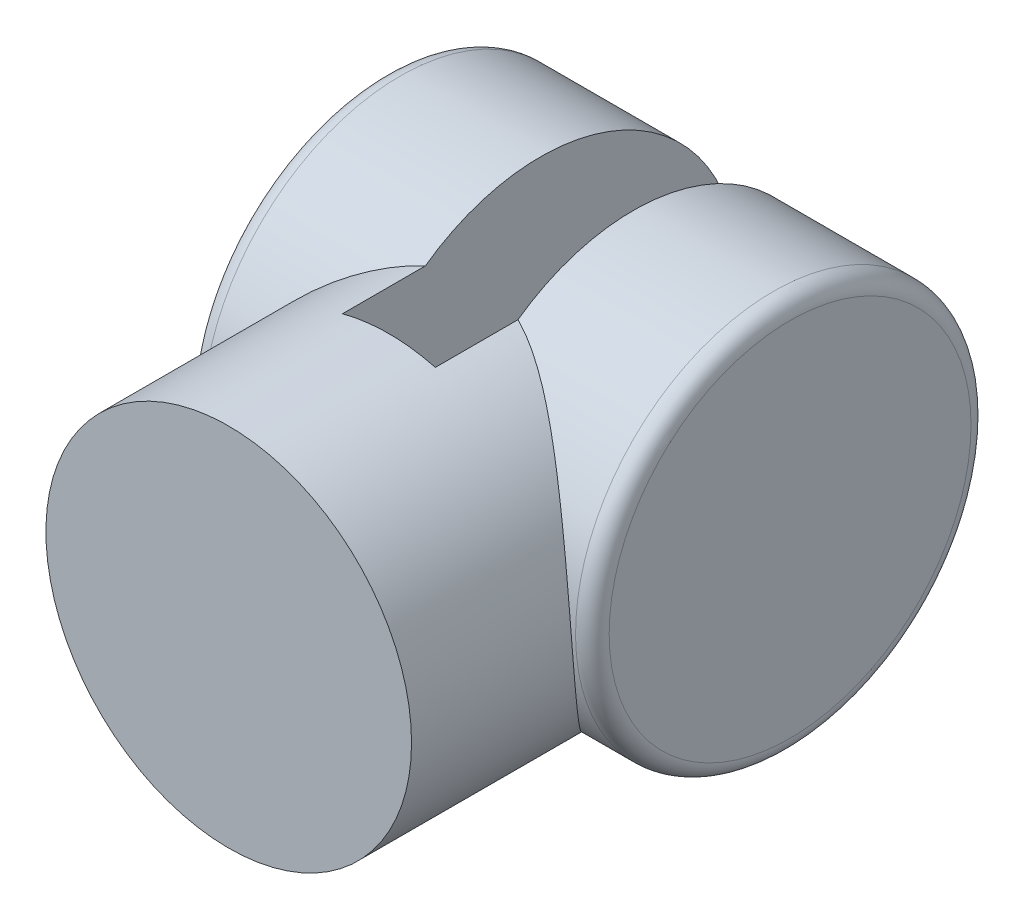
from build123d import *

# Parameters (mm, degrees)
SKETCH1_R               = 62.738
BOSS_EXTRUDE1_DEPTH     = 129.032
FILLET1_R               = 5.334
FILLET2_R               = 5.334
CUT_EXTRUDE1_DEPTH      = 157.593008583
CUT_EXTRUDE1_DEPTH_BACK = 157.593008583
SKETCH2_W               = 29.464
SKETCH2_H               = 125.476
BOSS_EXTRUDE2_START     = 10.518
BOSS_EXTRUDE2_OUTLINE_R = 58
BOSS_EXTRUDE2_DEPTH     = 103.032
CUT_EXTRUDE2_DEPTH      = 184.092449966
CUT_EXTRUDE2_DEPTH_BACK = 184.092449966
SKETCH3_W               = 29.464
SKETCH3_H               = 125.5


# Read off the part's stored shape, not the designer's step: Boss-Extrude2
with BuildPart() as part:
    # Sketch1 → Boss-Extrude1 (new body)
    with BuildSketch(Plane(origin=(0, 0, 0), x_dir=(0, 0, -1), z_dir=(1, 0, 0))):
        Circle(SKETCH1_R)
    extrude(amount=BOSS_EXTRUDE1_DEPTH)

    # Fillet1
    fillet1_edges = [part.edges().sort_by_distance(p)[0] for p in [
        (0, 0, 62.738),
    ]]
    fillet(fillet1_edges, radius=FILLET1_R)

    # Fillet2
    fillet2_edges = [part.edges().sort_by_distance(p)[0] for p in [
        (129.032, 0, 62.738),
    ]]
    fillet(fillet2_edges, radius=FILLET2_R)

    # Sketch2 → Cut-Extrude1 (cut, two sides: drawn at the far end of the back side and taken through both)
    with BuildSketch(Plane.XY.offset(-CUT_EXTRUDE1_DEPTH_BACK)):
        with Locations((64.516, 0)):
            Rectangle(SKETCH2_W, SKETCH2_H)
    extrude(amount=CUT_EXTRUDE1_DEPTH + CUT_EXTRUDE1_DEPTH_BACK, mode=Mode.SUBTRACT)


with BuildPart() as cut_extrude1_piece_1:
    # of the separate pieces the step leaves, piece 1, a body of its own (cut_extrude1_pieces)
    add(part.part.solids().sort_by_distance((5.334, 0, -62.738))[0])



with BuildPart() as cut_extrude1_piece_2:
    # of the separate pieces the step leaves, piece 2, a body of its own (cut_extrude1_pieces)
    add(part.part.solids().sort_by_distance((79.248, 0, -62.738))[0])


with BuildPart() as cut_extrude1_piece_1_1:
    add(cut_extrude1_piece_1.part)

    add(cut_extrude1_piece_2.part)  # Boss-Extrude2 merges Cut-Extrude1 piece 2
    # Boss-Extrude2 outline → Boss-Extrude2 (add)
    with BuildSketch(Plane.XY.offset(BOSS_EXTRUDE2_START)):
        with Locations((64.483080673, -5.087127651)):
            Circle(BOSS_EXTRUDE2_OUTLINE_R)
    extrude(amount=BOSS_EXTRUDE2_DEPTH)

    # Sketch3 → Cut-Extrude2 (cut, two sides: drawn at the far end of the back side and taken through both)
    with BuildSketch(Plane(origin=(0, 0, 0), x_dir=(1, 0, 0), z_dir=(0, 1, 0)).offset(-CUT_EXTRUDE2_DEPTH_BACK)):
        with Locations((64.516, -0.012)):
            Rectangle(SKETCH3_W, SKETCH3_H)
    extrude(amount=CUT_EXTRUDE2_DEPTH + CUT_EXTRUDE2_DEPTH_BACK, mode=Mode.SUBTRACT)


solid = cut_extrude1_piece_1_1.part
